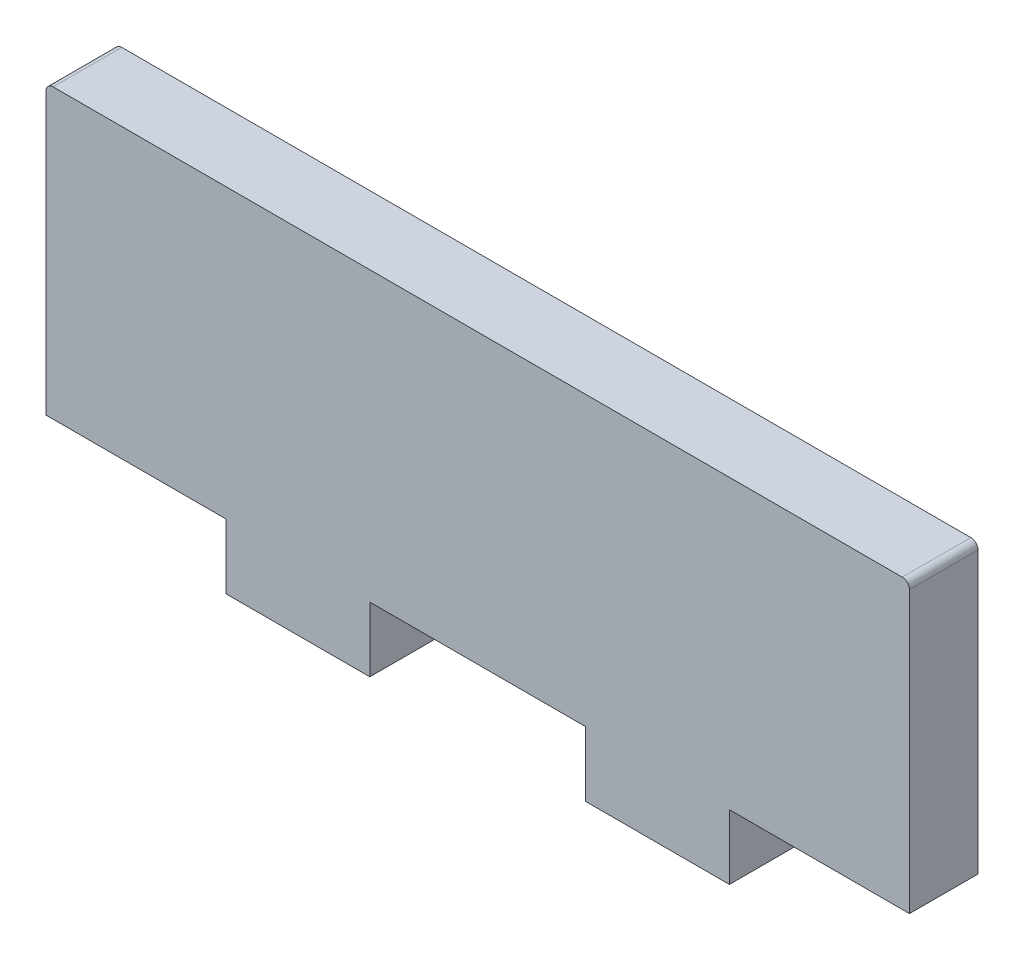
from build123d import *

# Parameters (mm, degrees)
BOSS_EXTRUDE1_DEPTH = 4.7625
FILLET1_R           = 1


with BuildPart() as part:
    # Sketch1 → Boss-Extrude1 (new, symmetric)
    with BuildSketch(Plane.XY):
        Polygon((60, 20), (-60, 20), (-60, -20), (-34.98, -20), (-34.98, -29), (-15, -29), (-15, -20), (15, -20), (15, -29), (34.98, -29), (34.98, -20), (60, -20), align=None)
    extrude(amount=BOSS_EXTRUDE1_DEPTH, both=True)

    # Fillet1
    fillet1_edges = [part.edges().sort_by_distance(p)[0] for p in [
        (60, 20, 0),
        (-60, 20, 0),
    ]]
    fillet(fillet1_edges, radius=FILLET1_R)


solid = part.part
